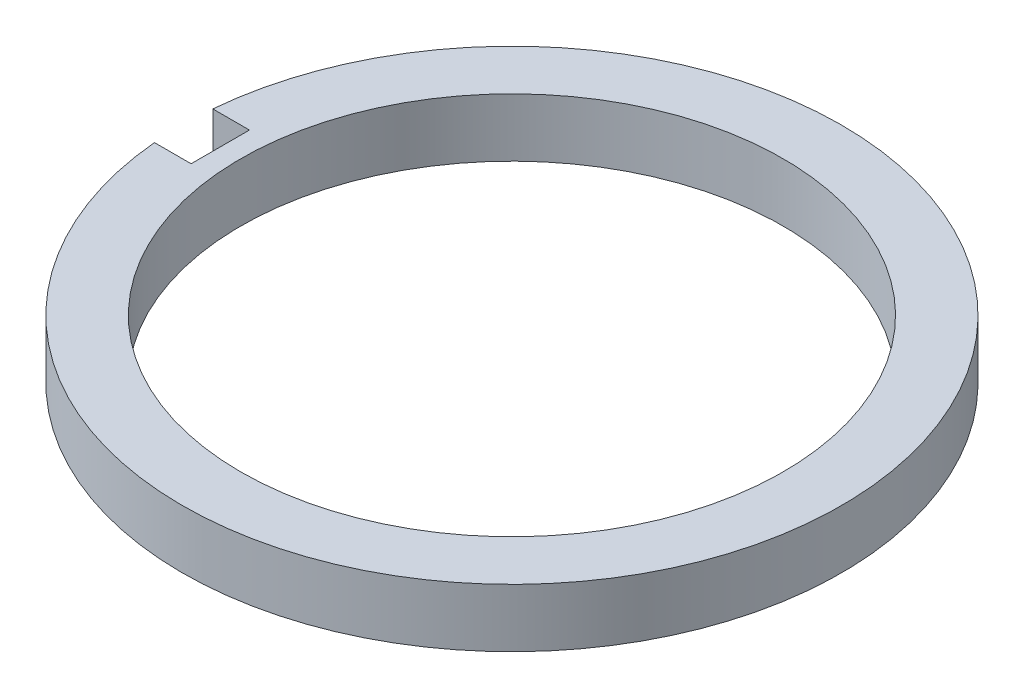
from build123d import *

# Parameters (mm, degrees)
SKETCH1_R           = 71.755
SKETCH1_R_2         = 59.055
BOSS_EXTRUDE1_DEPTH = 12.7
SKETCH2_W           = 25.4
SKETCH2_H           = 12.7
CUT_EXTRUDE1_DEPTH  = 103.26851935


with BuildPart() as part:
    # Sketch1 → Boss-Extrude1 (new body)
    with BuildSketch(Plane(origin=(0, 0, 0), x_dir=(1, 0, 0), z_dir=(0, 1, 0))):
        Circle(SKETCH1_R)
        Circle(SKETCH1_R_2, mode=Mode.SUBTRACT)
    extrude(amount=BOSS_EXTRUDE1_DEPTH)

    # Sketch2 → Cut-Extrude1 (cut, through all)
    with BuildSketch(Plane(origin=(0, 12.7, 0), x_dir=(1, 0, 0), z_dir=(0, 1, 0))):
        with Locations((-76.2, 0)):
            Rectangle(SKETCH2_W, SKETCH2_H)
    extrude(amount=-CUT_EXTRUDE1_DEPTH, mode=Mode.SUBTRACT)


solid = part.part
